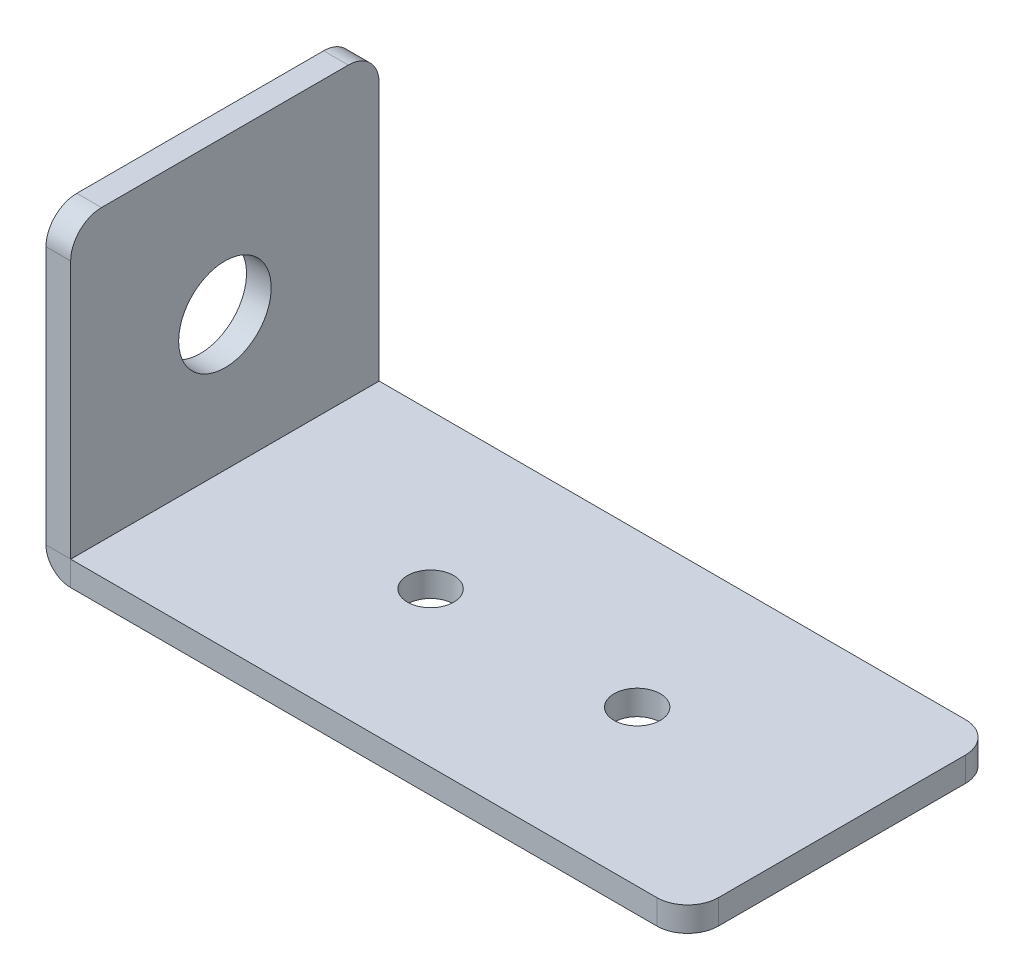
from build123d import *

# Parameters (mm, degrees)
SKETCH1_R                  = 3
SKETCH1_R_2                = 1.5
BASE_FLANGE1_DEPTH         = 1.6
SKETCHED_START             = -30
SKETCHED_BEND1_OUTLINE_W   = 1.6
SKETCHED_BEND1_OUTLINE_H   = 20
SKETCHED_BEND1_DEPTH       = 18.399
SKETCHED_START_2           = -11.601
SKETCHED_BEND1_2_OUTLINE_R = 3
SKETCHED_BEND1_2_DEPTH     = 1.6
SKETCHED_START_3           = -11
SKETCHED_BEND1_3_DEPTH     = 22
SKETCHED_START_4           = -10
SKETCHED_BEND1_4_DEPTH     = 20


with BuildPart() as part:
    # Base-Flange1: sheet metal written as solids
    # Sketch1 → Base-Flange1 (new body)
    with BuildSketch(Plane(origin=(0, 0, 0), x_dir=(1, 0, 0), z_dir=(0, 1, 0))):
        with BuildLine():
            Line((-28, -10), (28, -10))
            ThreePointArc((28, -10), (29.414213562, -9.414213562), (30, -8))
            Line((30, -8), (30, 8))
            ThreePointArc((30, 8), (29.414213562, 9.414213562), (28, 10))
            Line((28, 10), (-28, 10))
            ThreePointArc((-28, 10), (-29.414213562, 9.414213562), (-30, 8))
            Line((-30, 8), (-30, -8))
            ThreePointArc((-30, -8), (-29.414213562, -9.414213562), (-28, -10))
        make_face()
        with Locations(Location((-20, 0, 0), (0, 0, 270))):
            Circle(SKETCH1_R, mode=Mode.SUBTRACT)
        with Locations(Location((16.666666667, 0.059373734, 0), (0, 0, 270))):
            Circle(SKETCH1_R_2, mode=Mode.SUBTRACT)
        with Locations(Location((3.333333333, 0, 0), (0, 0, 270))):
            Circle(SKETCH1_R_2, mode=Mode.SUBTRACT)
    extrude(amount=-BASE_FLANGE1_DEPTH)

    # Sketched Bend1: read off the stored shape, not the designer's step
    # Sketched Bend1 outline → Sketched Bend1 (cut)
    with BuildSketch(Plane.YZ.offset(SKETCHED_START)):
        with Locations((-0.8, 0)):
            Rectangle(SKETCHED_BEND1_OUTLINE_W, SKETCHED_BEND1_OUTLINE_H)
    extrude(amount=SKETCHED_BEND1_DEPTH, mode=Mode.SUBTRACT)

    # Sketched Bend1 2 outline → Sketched Bend1 2 (add)
    with BuildSketch(Plane.YZ.offset(SKETCHED_START_2)):
        with BuildLine():
            ThreePointArc((18.742792142, 8), (18.157005705, 9.414213563), (16.742792142, 10))
            Line((16.742792142, 10), (0, 10))
            Line((0, 10), (0, -10))
            Line((0, -10), (16.742792142, -10))
            ThreePointArc((16.742792142, -10), (18.157005705, -9.414213563), (18.742792142, -8))
            Line((18.742792142, -8), (18.742792142, 8))
        make_face()
        with Locations((8.742792142, 0)):
            Circle(SKETCHED_BEND1_2_OUTLINE_R, mode=Mode.SUBTRACT)
    extrude(amount=SKETCHED_BEND1_2_DEPTH)

    # Sketched Bend1 3 outline → Sketched Bend1 3 (cut)
    with BuildSketch(Plane.XY.offset(SKETCHED_START_3)):
        with BuildLine():
            Line((-11.601, -1.6), (-10, -1.6))
            ThreePointArc((-10, -1.6), (-11.132077957, -1.131077957), (-11.601, 0.001))
            Line((-11.601, 0.001), (-11.601, -1.6))
        make_face()
    extrude(amount=SKETCHED_BEND1_3_DEPTH, mode=Mode.SUBTRACT)

    # Sketched Bend1 4 outline → Sketched Bend1 4 (add)
    with BuildSketch(Plane.XY.offset(SKETCHED_START_4)):
        with BuildLine():
            Line((-10.001, 0), (-10, 0))
            ThreePointArc((-10, 0), (-10.000707107, 0.000292893), (-10.001, 0.001))
            Line((-10.001, 0.001), (-10.001, 0))
        make_face()
    extrude(amount=SKETCHED_BEND1_4_DEPTH)


solid = part.part
